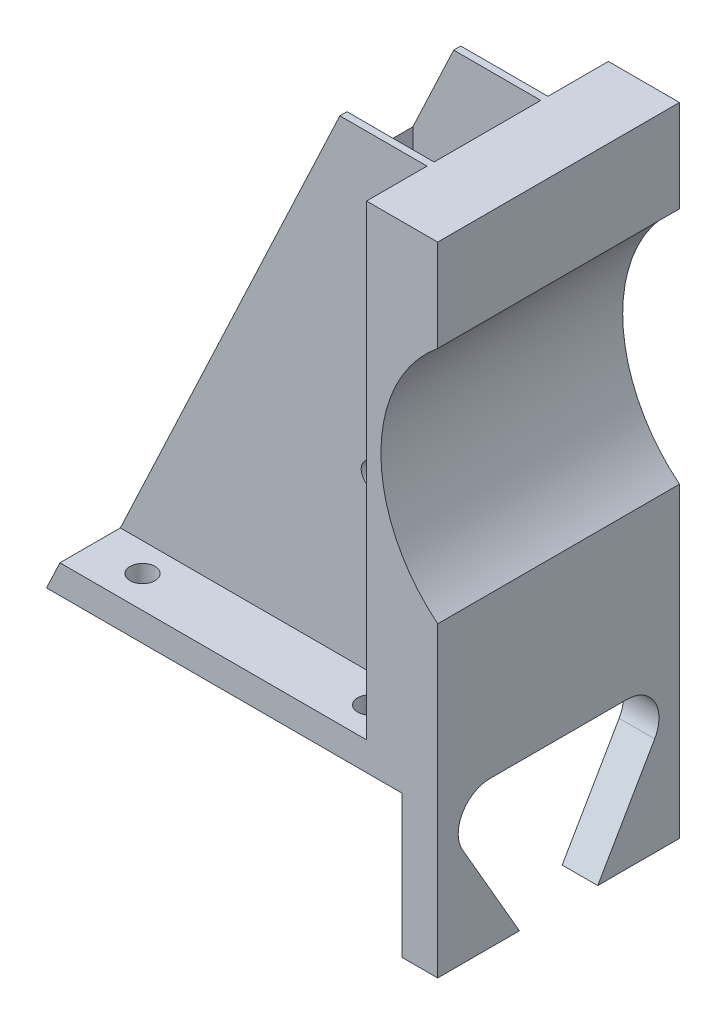
from build123d import *

# Parameters (mm, degrees)
BOSS_EXTRUDE2_DEPTH = 34
SKETCH5_W           = 50
SKETCH5_H           = 20
CUT_EXTRUDE1_DEPTH  = 8.5
SKETCH6_W           = 50
SKETCH6_H           = 20
CUT_EXTRUDE2_DEPTH  = 8.5
SKETCH7_W           = 52.006330756
SKETCH7_H           = 21.627895193
CUT_EXTRUDE3_DEPTH  = 89.815645226
CUT_EXTRUDE4_DEPTH  = 103.562024341
SKETCH10_R          = 1.75
CUT_EXTRUDE5_DEPTH  = 10
SKETCH14_W          = 15
SKETCH14_H          = 37
CUT_EXTRUDE8_DEPTH  = 18
SKETCH15_W          = 18
SKETCH15_H          = 15
CUT_EXTRUDE9_DEPTH  = 9
SKETCH16_W          = 13
SKETCH16_H          = 9
CUT_EXTRUDE10_DEPTH = 98.565203048
SKETCH17_R          = 1.75
CUT_EXTRUDE11_DEPTH = 89.81564526


with BuildPart() as part:
    # Sketch4 → Boss-Extrude2 (new body)
    with BuildSketch(Plane.XY):
        with BuildLine():
            Line((-25, -10), (30, -10))
            Line((30, -10), (30, 33.12936123))
            ThreePointArc((30, 33.12936123), (22.015013929, 49.89336123), (30, 66.65736123))
            Line((30, 66.65736123), (30, 79.61136123))
            Line((30, 79.61136123), (7.747226033, 79.61136123))
            Line((7.747226033, 79.61136123), (-25, 10))
            Line((-25, 10), (-25, -10))
        make_face()
    extrude(amount=BOSS_EXTRUDE2_DEPTH)

    # Sketch5 → Cut-Extrude1 (cut)
    with BuildSketch(Plane.XY.offset(34)):
        Polygon((-23.118282679, 14), (7.747226033, 79.61136123), (20, 79.61136123), (20, 14), align=None)
        Rectangle(SKETCH5_W, SKETCH5_H)
    extrude(amount=-CUT_EXTRUDE1_DEPTH, mode=Mode.SUBTRACT)

    # Sketch6 → Cut-Extrude2 (cut)
    with BuildSketch(Plane(origin=(0, 0, 0), x_dir=(-1, 0, 0), z_dir=(0, 0, -1))):
        Polygon((23.118282679, 14), (-20, 14), (-20, 79.61136123), (-7.747226033, 79.61136123), align=None)
        Rectangle(SKETCH6_W, SKETCH6_H)
    extrude(amount=-CUT_EXTRUDE2_DEPTH, mode=Mode.SUBTRACT)

    # Sketch7 → Cut-Extrude3 (cut, through all)
    with BuildSketch(Plane(origin=(0, 0, 8.5), x_dir=(-1, 0, 0), z_dir=(0, 0, -1))):
        with Locations((1.003165378, -0.813947597)):
            Rectangle(SKETCH7_W, SKETCH7_H)
    extrude(amount=-CUT_EXTRUDE3_DEPTH, mode=Mode.SUBTRACT)

    # Sketch9 → Cut-Extrude4 (cut, through all)
    with BuildSketch(Plane(origin=(30, 0, 0), x_dir=(0, 0, -1), z_dir=(1, 0, 0))):
        with BuildLine():
            Line((-26.615, 10.614680615), (-7.385, 10.614680615))
            ThreePointArc((-7.385, 10.614680615), (-3.487778361, 8.364494718), (-3.488100353, 3.864308837))
            Line((-3.488100353, 3.864308837), (-13.103100353, -12.785691163))
            ThreePointArc((-13.103100353, -12.785691163), (-17, -15.035319385), (-20.896899647, -12.785691163))
            Line((-20.896899647, -12.785691163), (-30.511899647, 3.864308837))
            ThreePointArc((-30.511899647, 3.864308837), (-30.512221639, 8.364494718), (-26.615, 10.614680615))
        make_face()
    extrude(amount=-CUT_EXTRUDE4_DEPTH, mode=Mode.SUBTRACT)

    # Sketch10 → Cut-Extrude5 (cut)
    with BuildSketch(Plane.XZ.offset(-10)):
        with Locations((16, 29.5)):
            Circle(SKETCH10_R)
        with Locations((16, 4.5)):
            Circle(SKETCH10_R)
        with Locations((-16, 29.5)):
            Circle(SKETCH10_R)
        with Locations((-16, 4.5)):
            Circle(SKETCH10_R)
    extrude(amount=-CUT_EXTRUDE5_DEPTH, mode=Mode.SUBTRACT)

    # Sketch14 → Cut-Extrude8 (cut)
    with BuildSketch(Plane.ZY.offset(-20)):
        with Locations((17, 61.11136123)):
            Rectangle(SKETCH14_W, SKETCH14_H)
    extrude(amount=CUT_EXTRUDE8_DEPTH, mode=Mode.SUBTRACT)

    # Sketch15 → Cut-Extrude9 (cut)
    with BuildSketch(Plane(origin=(0, 42.61136123, 0), x_dir=(1, 0, 0), z_dir=(0, 1, 0))):
        with Locations((11, -17)):
            Rectangle(SKETCH15_W, SKETCH15_H)
    extrude(amount=-CUT_EXTRUDE9_DEPTH, mode=Mode.SUBTRACT)

    # Sketch16 → Cut-Extrude10 (cut, through all)
    with BuildSketch(Plane.ZY.offset(-20)):
        with Locations((17, 38.11136123)):
            Rectangle(SKETCH16_W, SKETCH16_H)
    extrude(amount=CUT_EXTRUDE10_DEPTH, mode=Mode.SUBTRACT)

    # Sketch17 → Cut-Extrude11 (cut, through all)
    with BuildSketch(Plane.XY.offset(25.5)):
        with Locations((12.5, 38.11136123)):
            Circle(SKETCH17_R)
    extrude(amount=-CUT_EXTRUDE11_DEPTH, mode=Mode.SUBTRACT)


solid = part.part
